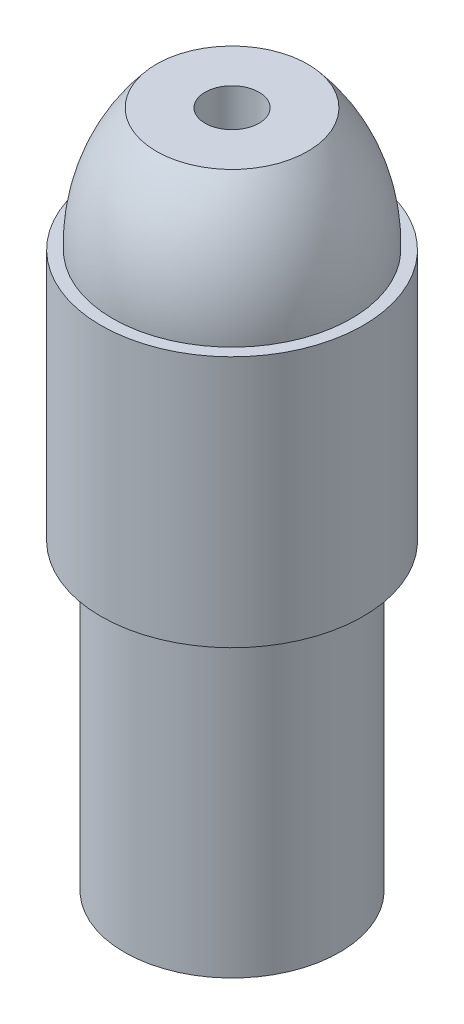
from build123d import *

# Parameters (mm, degrees)
SKETCH1_R           = 4.69
BOSS_EXTRUDE1_DEPTH = 13.2
SKETCH2_R           = 5.717952417
BOSS_EXTRUDE2_DEPTH = 16.35
SKETCH4_R           = 1.175
CUT_EXTRUDE1_DEPTH  = 31.636456479


with BuildPart() as part:
    # Sketch1 → Boss-Extrude1 (new body)
    with BuildSketch(Plane(origin=(0, 0, 0), x_dir=(1, 0, 0), z_dir=(0, 1, 0))):
        with Locations(Location((0, 0, 0), (0, 0, 270))):
            Circle(SKETCH1_R)
    extrude(amount=BOSS_EXTRUDE1_DEPTH)

    # Sketch2 → Boss-Extrude2 (add)
    with BuildSketch(Plane(origin=(0, 13.2, 0), x_dir=(1, 0, 0), z_dir=(0, 1, 0))):
        with Locations(Location((0, 0, 0), (0, 0, 270))):
            Circle(SKETCH2_R)
    extrude(amount=BOSS_EXTRUDE2_DEPTH)

    # Sketch3 → Cut-Revolve1 (revolve, cut)
    with BuildSketch(Plane.XY, mode=Mode.PRIVATE) as cut_revolve1_sk:
        with BuildLine():
            Line((3.297149576, 29.55), (5.717952417, 29.55))
            Line((5.717952417, 29.55), (5.717952417, 24.186874615))
            Line((5.717952417, 24.186874615), (5.202740875, 24.186874615))
            ThreePointArc((5.202740875, 24.186874615), (4.750212863, 27.046189194), (3.297149576, 29.55))
        make_face()
    revolve(cut_revolve1_sk.sketch.rotate(Axis((0, 29.55, 0), (0, -1, 0)), 90), axis=Axis((0, 29.55, 0), (0, -1, 0)), mode=Mode.SUBTRACT)

    # Sketch4 → Cut-Extrude1 (cut, through all)
    with BuildSketch(Plane.XZ):
        with Locations(Location((0, 0, 0), (0, 0, 270))):
            Circle(SKETCH4_R)
    extrude(amount=-CUT_EXTRUDE1_DEPTH, mode=Mode.SUBTRACT)


solid = part.part
